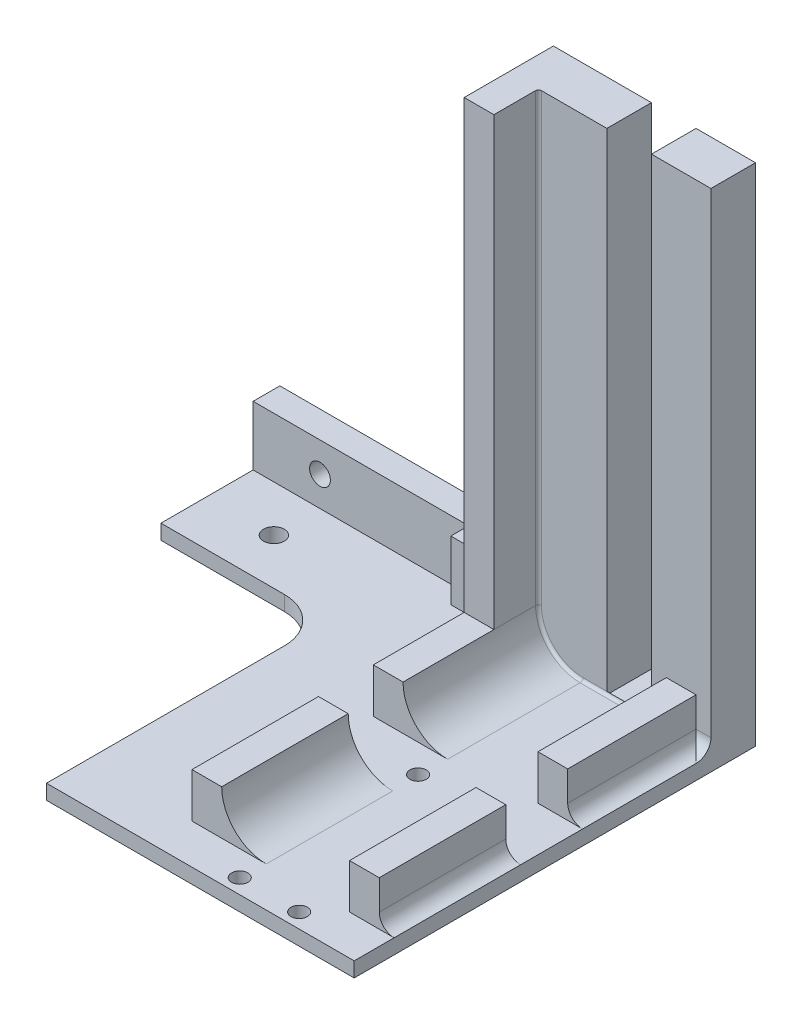
from build123d import *

# Parameters (mm, degrees)
BOSS_EXTRUDE1_DEPTH      = 250
BOSS_EXTRUDE2_DEPTH      = 50
BOSS_EXTRUDE2_2_DEPTH    = 50
LPATTERN1_COUNT          = 4
LPATTERN1_PITCH          = 60
SKETCH2_R                = 2.75
CUT_EXTRUDE1_DEPTH       = 251.864711302
UPPER_ACRYLIC_SUPP_W     = 20
UPPER_ACRYLIC_SUPP_H     = 250
BOSS_EXTRUDE3_DEPTH      = 5
UPPER_ACRYLIC_SUPP_3_W   = 10
UPPER_ACRYLIC_SUPP_3_H   = 66.073604859
UPPER_ACRYLIC_SUPP_3_H_2 = 41.475217291
UPPER_ACRYLIC_SUPP_3_H_3 = 42.557179481
UPPER_ACRYLIC_SUPP_3_H_4 = 45.558340935
BOSS_EXTRUDE4_DEPTH      = 15
FILLET1_R                = 15
SKETCH4_W                = 60
SKETCH4_H                = 15
BOSS_EXTRUDE5_DEPTH      = 5
SKETCH4_3_W              = 60
SKETCH4_3_H              = 15
BOSS_EXTRUDE6_DEPTH      = 60
SKETCH5_W                = 10
SKETCH5_H                = 45
BOSS_EXTRUDE7_DEPTH      = 15
BOSS_EXTRUDE8_START      = 250
SKETCH5_3_W              = 10
SKETCH5_3_H              = 45
BOSS_EXTRUDE8_DEPTH      = 15
FILLET2_R                = 1
SKETCH6_W                = 6
SKETCH6_H                = 60
CUT_EXTRUDE2_DEPTH       = 6
BOSS_EXTRUDE9_DEPTH      = 30
SKETCH8_W                = 333.602701612
SKETCH8_H                = 59.031331047
CUT_EXTRUDE3_DEPTH       = 150
SKETCH9_W                = 6
SKETCH9_H                = 20
CLOTH_ESCAPE_GAP_DEPTH   = 20
SKETCH11_W               = 9
SKETCH11_H               = 20
BOSS_EXTRUDE11_DEPTH     = 100
CUT_EXTRUDE4_DEPTH       = 68
SKETCH13_W               = 40
SKETCH13_H               = 5
BOSS_EXTRUDE13_DEPTH     = 100
CUT_EXTRUDE5_DEPTH       = 100
FILLET3_R                = 15
BOSS_EXTRUDE14_START     = -5
BOSS_EXTRUDE14_DEPTH     = 25
CUT_EXTRUDE6_DEPTH       = 30
CUT_EXTRUDE6_DEPTH_BACK  = 10
SKETCH16_5_W             = 8.5
SKETCH16_5_H             = 41.475217291
SKETCH16_5_H_2           = 42.557179481
SKETCH16_5_W_2           = 1.5
SKETCH16_5_H_3           = 42.177819043
SKETCH16_5_H_4           = 20.831100018
SKETCH16_5_H_5           = 17.311395043
SKETCH16_5_H_6           = 18.573684265
SKETCH16_5_H_7           = 65.073604859
SKETCH16_6_W             = 8.5
SKETCH16_6_H             = 41.475217291
SKETCH16_6_H_2           = 42.557179481
SKETCH16_6_W_2           = 1.5
SKETCH16_6_H_3           = 42.177819043
SKETCH16_6_H_4           = 20.831100018
SKETCH16_6_H_5           = 17.311395043
SKETCH16_6_H_6           = 18.573684265
SKETCH16_6_H_7           = 65.073604859
BOSS_EXTRUDE15_DEPTH     = 5
BOSS_EXTRUDE16_DEPTH     = 20
SKETCH16_8_W             = 8.5
SKETCH16_8_H             = 41.475217291
SKETCH16_8_H_2           = 42.557179481
SKETCH16_8_W_2           = 1.5
SKETCH16_8_H_3           = 42.177819043
SKETCH16_8_H_4           = 65.073604859
BOSS_EXTRUDE17_DEPTH     = 15
BOSS_EXTRUDE18_START     = -5
BOSS_EXTRUDE18_DEPTH     = 25
FILLET4_R                = 5
BOSS_EXTRUDE21_START     = 145
BOSS_EXTRUDE21_DEPTH     = 170
SKETCH19_R               = 3.5
CUT_EXTRUDE7_DEPTH       = 10
CUT_EXTRUDE8_DEPTH       = 355
CUT_EXTRUDE8_DEPTH_BACK  = 10
SKETCH20_R               = 3.5
SKETCH21_W               = 15
SKETCH21_H               = 197.501027769
CUT_EXTRUDE9_DEPTH       = 130
SKETCH22_W               = 160
SKETCH22_H               = 135
SKETCH22_H_2             = 10
CUT_EXTRUDE10_DEPTH      = 270


with BuildPart() as part:
    # profile → Boss-Extrude1 (new body)
    with BuildSketch(Plane.XY):
        Polygon((-14.746446609, 10.353553391), (-5.253553391, 10.353553391), (5.667330529, 10.353553391), (14.746446609, 10.353553391), (20, 10.353553391), (20, 15.353553391), (-20, 15.353553391), (-20, 10.353553391), align=None)
    extrude(amount=BOSS_EXTRUDE1_DEPTH)

    # Sketch2 → Cut-Extrude1 (cut, through all)
    with BuildSketch(Plane.XZ.offset(-10.353553391)):
        with Locations(Location((-10, 175, 0), (0, 0, 270))):
            Circle(SKETCH2_R)
        with Locations(Location((10, 175, 0), (0, 0, 270))):
            Circle(SKETCH2_R)
        with Locations(Location((-10, 115, 0), (0, 0, 270))):
            Circle(SKETCH2_R)
        with Locations(Location((10, 115, 0), (0, 0, 270))):
            Circle(SKETCH2_R)
        with Locations(Location((-10, 55, 0), (0, 0, 270))):
            Circle(SKETCH2_R)
        with Locations(Location((10, 55, 0), (0, 0, 270))):
            Circle(SKETCH2_R)
    extrude(amount=-CUT_EXTRUDE1_DEPTH, mode=Mode.SUBTRACT)

    # upper_acrylic_supp → Boss-Extrude3 (add)
    with BuildSketch(Plane(origin=(0, 15.353553391, 0), x_dir=(1, 0, 0), z_dir=(0, 1, 0))):
        with Locations((-30, -125)):
            Rectangle(UPPER_ACRYLIC_SUPP_W, UPPER_ACRYLIC_SUPP_H)
    extrude(amount=-BOSS_EXTRUDE3_DEPTH)

    # upper_acrylic_supp<3> → Boss-Extrude4 (add)
    with BuildSketch(Plane(origin=(0, 15.353553391, 0), x_dir=(1, 0, 0), z_dir=(0, 1, 0))):
        with Locations((-29.5, -216.963197571)):
            Rectangle(UPPER_ACRYLIC_SUPP_3_W, UPPER_ACRYLIC_SUPP_3_H)
        with Locations((-29.5, -144.615102231)):
            Rectangle(UPPER_ACRYLIC_SUPP_3_W, UPPER_ACRYLIC_SUPP_3_H_2)
        with Locations((-29.5, -85.287508801)):
            Rectangle(UPPER_ACRYLIC_SUPP_3_W, UPPER_ACRYLIC_SUPP_3_H_3)
        with Locations((-29.5, -22.779170468)):
            Rectangle(UPPER_ACRYLIC_SUPP_3_W, UPPER_ACRYLIC_SUPP_3_H_4)
    extrude(amount=BOSS_EXTRUDE4_DEPTH)

    # Fillet1
    fillet1_edges = [part.edges().sort_by_distance(p)[0] for p in [
        (-24.5, 15.353553391, 22.779170467),
        (-24.5, 15.353553391, 85.287508801),
        (-24.5, 15.353553391, 144.615102231),
        (-24.5, 15.353553391, 216.963197571),
    ]]
    fillet(fillet1_edges, radius=FILLET1_R - 0.0001)  # a hair under: the kernel refuses the full size



with BuildPart() as body_2:
    # Sketch1<3> → Boss-Extrude2 (new body)
    with BuildSketch(Plane.XY):
        Polygon((-7.253553391, 8.353553391), (-8.119669914, 7.487436867), (-5.5, 7.487436867), (-4.987436867, 7.487436867), (-5.5, 6.974873734), (-7.874873734, 4.6), (-12.125126266, 4.6), (-14.5, 6.974873734), (-15.012563133, 7.487436867), (-14.5, 7.487436867), (-11.880330086, 7.487436867), (-12.746446609, 8.353553391), (-14.746446609, 10.353553391), (-5.253553391, 10.353553391), align=None)
    boss_extrude2 = extrude(amount=BOSS_EXTRUDE2_DEPTH)


with BuildPart() as body_3:
    # Sketch1<3> → Boss-Extrude2 2 (new body)
    with BuildSketch(Plane.XY):
        Polygon((12.746446609, 8.353553391), (11.880330086, 7.487436867), (14.5, 7.487436867), (15.012563133, 7.487436867), (14.5, 6.974873734), (12.125126266, 4.6), (7.874873734, 4.6), (5.5, 6.974873734), (4.987436867, 7.487436867), (5.5, 7.487436867), (8.533447053, 7.487436867), (7.667330529, 8.353553391), (5.667330529, 10.353553391), (14.746446609, 10.353553391), align=None)
    boss_extrude2_2 = extrude(amount=BOSS_EXTRUDE2_2_DEPTH)


with BuildPart() as lpattern1_1:
    # LPattern1: pattern copy
    add(boss_extrude2.moved(Location(Vector(0, 0, 1) * (1 * LPATTERN1_PITCH))))


with BuildPart() as lpattern1_2:
    # LPattern1: pattern copy
    add(boss_extrude2.moved(Location(Vector(0, 0, 1) * (2 * LPATTERN1_PITCH))))


with BuildPart() as lpattern1_3:
    # LPattern1: pattern copy
    add(boss_extrude2.moved(Location(Vector(0, 0, 1) * (3 * LPATTERN1_PITCH))))


with BuildPart() as lpattern1_4:
    # LPattern1: pattern copy
    add(boss_extrude2_2.moved(Location(Vector(0, 0, 1) * (1 * LPATTERN1_PITCH))))


with BuildPart() as lpattern1_5:
    # LPattern1: pattern copy
    add(boss_extrude2_2.moved(Location(Vector(0, 0, 1) * (2 * LPATTERN1_PITCH))))


with BuildPart() as lpattern1_6:
    # LPattern1: pattern copy
    add(boss_extrude2_2.moved(Location(Vector(0, 0, 1) * (3 * LPATTERN1_PITCH))))


with BuildPart() as part_1:
    add(part.part)

    add(body_2.part)  # Boss-Extrude5 merges body 2

    add(body_3.part)  # Boss-Extrude5 merges body 3
    # Sketch4 → Boss-Extrude5 (add, symmetric)
    with BuildSketch(Plane(origin=(0, 15.353553391, 0), x_dir=(1, 0, 0), z_dir=(0, 1, 0))):
        with Locations((-10, -257.5)):
            Rectangle(SKETCH4_W, SKETCH4_H)
        with Locations((-10, 7.5)):
            Rectangle(SKETCH4_W, SKETCH4_H)
    extrude(amount=BOSS_EXTRUDE5_DEPTH, both=True)

    # Sketch4<3> → Boss-Extrude6 (add)
    with BuildSketch(Plane(origin=(0, 15.353553391, 0), x_dir=(1, 0, 0), z_dir=(0, 1, 0))):
        with Locations((-10, -257.5)):
            Rectangle(SKETCH4_3_W, SKETCH4_3_H)
        with Locations((-10, 7.5)):
            Rectangle(SKETCH4_3_W, SKETCH4_3_H)
    extrude(amount=BOSS_EXTRUDE6_DEPTH)

    # Sketch5 → Boss-Extrude7 (add)
    with BuildSketch(Plane(origin=(0, 0, 250), x_dir=(-1, 0, 0), z_dir=(0, 0, -1))):
        with Locations((29.5, 52.853553391)):
            Rectangle(SKETCH5_W, SKETCH5_H)
    extrude(amount=BOSS_EXTRUDE7_DEPTH)

    # Sketch5<3> → Boss-Extrude8 (add)
    with BuildSketch(Plane(origin=(0, 0, 250), x_dir=(-1, 0, 0), z_dir=(0, 0, -1)).offset(BOSS_EXTRUDE8_START)):
        with Locations((29.5, 52.853553391)):
            Rectangle(SKETCH5_3_W, SKETCH5_3_H)
    extrude(amount=-BOSS_EXTRUDE8_DEPTH)

    # Fillet2
    fillet2_edges = [part_1.edges().sort_by_distance(p)[0] for p in [
        (-24.5, 52.853503391, 250),
        (-24.5, 52.853503391, 0),
        (5.24995, 15.353553391, 250),
        (-20.106631007, 19.746922384, 250),
        (-20.106631007, 19.746922384, 0),
        (5.24995, 15.353553391, 0),
    ]]
    fillet(fillet2_edges, radius=FILLET2_R)

    # Sketch6 → Cut-Extrude2 (cut)
    with BuildSketch(Plane.ZY.offset(40)):
        with Locations((253, 45.353553391)):
            Rectangle(SKETCH6_W, SKETCH6_H)
        with Locations((-3, 45.353553391)):
            Rectangle(SKETCH6_W, SKETCH6_H)
    extrude(amount=-CUT_EXTRUDE2_DEPTH, mode=Mode.SUBTRACT)

    # Sketch7 → Boss-Extrude9 (add)
    with BuildSketch(Plane.ZY.offset(40)):
        Polygon((265, 75.353553391), (256, 75.353553391), (256, 15.353553391), (-6, 15.353553391), (-6, 75.353553391), (-15, 75.353553391), (-15, 10.353553391), (265, 10.353553391), align=None)
    extrude(amount=BOSS_EXTRUDE9_DEPTH)

    # Sketch8 → Cut-Extrude3 (cut)
    with BuildSketch(Plane.ZY.offset(70)):
        with Locations((122.426839416, 64.869218915)):
            Rectangle(SKETCH8_W, SKETCH8_H)
    extrude(amount=-CUT_EXTRUDE3_DEPTH, mode=Mode.SUBTRACT)

    # Sketch9 → cloth_escape_gap (add)
    with BuildSketch(Plane.ZY.offset(34)):
        with Locations((253, 25.353553391)):
            Rectangle(SKETCH9_W, SKETCH9_H)
        with Locations((-3, 25.353553391)):
            Rectangle(SKETCH9_W, SKETCH9_H)
    extrude(amount=CLOTH_ESCAPE_GAP_DEPTH)

    # Sketch11 → Boss-Extrude11 (add)
    with BuildSketch(Plane.ZY.offset(70)):
        with Locations((-10.5, 25.353553391)):
            Rectangle(SKETCH11_W, SKETCH11_H)
        with Locations((260.5, 25.353553391)):
            Rectangle(SKETCH11_W, SKETCH11_H)
    extrude(amount=BOSS_EXTRUDE11_DEPTH)

    # Sketch12 → Cut-Extrude4 (cut)
    with BuildSketch(Plane.XZ.offset(-10.353553391)):
        Polygon((-170, 265), (-70, 265), (-170, 260.5), align=None)
        Polygon((-70, -15), (-170, -10.5), (-170, -15), align=None)
    extrude(amount=-CUT_EXTRUDE4_DEPTH, mode=Mode.SUBTRACT)

    # Sketch13 → Boss-Extrude13 (add)
    with BuildSketch(Plane.ZY.offset(70)):
        with Locations((5, 12.853553391)):
            Rectangle(SKETCH13_W, SKETCH13_H)
        with Locations((245, 12.853553391)):
            Rectangle(SKETCH13_W, SKETCH13_H)
    extrude(amount=BOSS_EXTRUDE13_DEPTH)

    # Sketch14 → Cut-Extrude5 (cut)
    with BuildSketch(Plane(origin=(0, 15.353553391, 0), x_dir=(1, 0, 0), z_dir=(0, 1, 0))):
        Polygon((-70, -265), (-170, -260.5), (-170, -265), align=None)
        Polygon((-170, 15), (-170, 10.5), (-70, 15), align=None)
    extrude(amount=-CUT_EXTRUDE5_DEPTH, mode=Mode.SUBTRACT)

    # Fillet3
    fillet3_edges = [part_1.edges().sort_by_distance(p)[0] for p in [
        (-70, 12.853553391, 25),
        (-70, 12.853553391, 225),
    ]]
    fillet(fillet3_edges, radius=FILLET3_R)

    # Sketch16 → Boss-Extrude14 (add)
    with BuildSketch(Plane(origin=(0, 15.353553391, 0), x_dir=(1, 0, 0), z_dir=(0, 1, 0)).offset(BOSS_EXTRUDE14_START)):
        Polygon((28.5, 0), (33.5, 0), (33.5, 15), (18.5, 15), (18.5, 0), align=None)
        Polygon((18.5, -250), (18.5, -265), (33.5, -265), (33.5, -250), (28.5, -250), align=None)
    extrude(amount=BOSS_EXTRUDE14_DEPTH)

    # Sketch16<5> → Cut-Extrude6 (cut, two sides: drawn at the far end of the back side and taken through both)
    with BuildSketch(Plane(origin=(0, 15.353553391, 0), x_dir=(1, 0, 0), z_dir=(0, 1, 0)).offset(-CUT_EXTRUDE6_DEPTH_BACK)):
        Polygon((18.5, -250), (18.5, -265), (33.5, -265), (33.5, -250), (28.5, -250), align=None)
        Polygon((28.5, -250), (33.5, -250), (33.5, 0), (28.5, 0), (28.5, -43.177819043), (20, -43.177819043), (20, -64.008919061), (28.5, -64.008919061), (28.5, -106.566098542), (20, -106.566098542), (20, -123.877493585), (28.5, -123.877493585), (28.5, -165.352710876), (20, -165.352710876), (20, -183.926395141), (28.5, -183.926395141), align=None)
        with Locations((24.25, -144.615102231)):
            Rectangle(SKETCH16_5_W, SKETCH16_5_H)
        with Locations((24.25, -85.287508801)):
            Rectangle(SKETCH16_5_W, SKETCH16_5_H_2)
        Polygon((28.5, -43.177819043), (28.5, 0), (18.5, 0), (18.5, -1), (20, -1), (20, -43.177819043), align=None)
        Polygon((28.5, 0), (33.5, 0), (33.5, 15), (18.5, 15), (18.5, 0), align=None)
        with Locations((19.25, -22.088909521)):
            Rectangle(SKETCH16_5_W_2, SKETCH16_5_H_3)
        with Locations((19.25, -53.593369052)):
            Rectangle(SKETCH16_5_W_2, SKETCH16_5_H_4)
        with Locations((19.25, -85.287508801)):
            Rectangle(SKETCH16_5_W_2, SKETCH16_5_H_2)
        with Locations((19.25, -115.221796064)):
            Rectangle(SKETCH16_5_W_2, SKETCH16_5_H_5)
        with Locations((19.25, -144.615102231)):
            Rectangle(SKETCH16_5_W_2, SKETCH16_5_H)
        with Locations((19.25, -174.639553009)):
            Rectangle(SKETCH16_5_W_2, SKETCH16_5_H_6)
        with Locations((19.25, -216.463197571)):
            Rectangle(SKETCH16_5_W_2, SKETCH16_5_H_7)
        Polygon((18.5, -249), (18.5, -250), (28.5, -250), (28.5, -183.926395141), (20, -183.926395141), (20, -249), align=None)
    extrude(amount=CUT_EXTRUDE6_DEPTH + CUT_EXTRUDE6_DEPTH_BACK, mode=Mode.SUBTRACT)

    # Sketch16<6> → Boss-Extrude15 (add)
    with BuildSketch(Plane(origin=(0, 15.353553391, 0), x_dir=(1, 0, 0), z_dir=(0, 1, 0))):
        Polygon((28.5, -250), (33.5, -250), (33.5, 0), (28.5, 0), (28.5, -43.177819043), (20, -43.177819043), (20, -64.008919061), (28.5, -64.008919061), (28.5, -106.566098542), (20, -106.566098542), (20, -123.877493585), (28.5, -123.877493585), (28.5, -165.352710876), (20, -165.352710876), (20, -183.926395141), (28.5, -183.926395141), align=None)
        Polygon((18.5, -249), (18.5, -250), (28.5, -250), (28.5, -183.926395141), (20, -183.926395141), (20, -249), align=None)
        Polygon((18.5, -250), (18.5, -265), (33.5, -265), (33.5, -250), (28.5, -250), align=None)
        with Locations((24.25, -144.615102231)):
            Rectangle(SKETCH16_6_W, SKETCH16_6_H)
        with Locations((24.25, -85.287508801)):
            Rectangle(SKETCH16_6_W, SKETCH16_6_H_2)
        Polygon((28.5, -43.177819043), (28.5, 0), (18.5, 0), (18.5, -1), (20, -1), (20, -43.177819043), align=None)
        Polygon((28.5, 0), (33.5, 0), (33.5, 15), (18.5, 15), (18.5, 0), align=None)
        with Locations((19.25, -22.088909521)):
            Rectangle(SKETCH16_6_W_2, SKETCH16_6_H_3)
        with Locations((19.25, -53.593369052)):
            Rectangle(SKETCH16_6_W_2, SKETCH16_6_H_4)
        with Locations((19.25, -85.287508801)):
            Rectangle(SKETCH16_6_W_2, SKETCH16_6_H_2)
        with Locations((19.25, -115.221796064)):
            Rectangle(SKETCH16_6_W_2, SKETCH16_6_H_5)
        with Locations((19.25, -144.615102231)):
            Rectangle(SKETCH16_6_W_2, SKETCH16_6_H)
        with Locations((19.25, -174.639553009)):
            Rectangle(SKETCH16_6_W_2, SKETCH16_6_H_6)
        with Locations((19.25, -216.463197571)):
            Rectangle(SKETCH16_6_W_2, SKETCH16_6_H_7)
    extrude(amount=-BOSS_EXTRUDE15_DEPTH)

    # Sketch16<7> → Boss-Extrude16 (add)
    with BuildSketch(Plane(origin=(0, 15.353553391, 0), x_dir=(1, 0, 0), z_dir=(0, 1, 0))):
        Polygon((18.5, -250), (18.5, -265), (33.5, -265), (33.5, -250), (28.5, -250), align=None)
        Polygon((28.5, 0), (33.5, 0), (33.5, 15), (18.5, 15), (18.5, 0), align=None)
    extrude(amount=BOSS_EXTRUDE16_DEPTH)

    # Sketch16<8> → Boss-Extrude17 (add)
    with BuildSketch(Plane(origin=(0, 15.353553391, 0), x_dir=(1, 0, 0), z_dir=(0, 1, 0))):
        Polygon((18.5, -249), (18.5, -250), (28.5, -250), (28.5, -183.926395141), (20, -183.926395141), (20, -249), align=None)
        with Locations((24.25, -144.615102231)):
            Rectangle(SKETCH16_8_W, SKETCH16_8_H)
        with Locations((24.25, -85.287508801)):
            Rectangle(SKETCH16_8_W, SKETCH16_8_H_2)
        Polygon((28.5, -43.177819043), (28.5, 0), (18.5, 0), (18.5, -1), (20, -1), (20, -43.177819043), align=None)
        with Locations((19.25, -22.088909521)):
            Rectangle(SKETCH16_8_W_2, SKETCH16_8_H_3)
        with Locations((19.25, -85.287508801)):
            Rectangle(SKETCH16_8_W_2, SKETCH16_8_H_2)
        with Locations((19.25, -144.615102231)):
            Rectangle(SKETCH16_8_W_2, SKETCH16_8_H)
        with Locations((19.25, -216.463197571)):
            Rectangle(SKETCH16_8_W_2, SKETCH16_8_H_4)
    extrude(amount=BOSS_EXTRUDE17_DEPTH)

    # Sketch14<2> → Boss-Extrude18 (add)
    with BuildSketch(Plane(origin=(0, 15.353553391, 0), x_dir=(1, 0, 0), z_dir=(0, 1, 0)).offset(BOSS_EXTRUDE18_START)):
        Polygon((-70, -265), (-170, -260.5), (-170, -265), align=None)
        Polygon((-170, 15), (-170, 10.5), (-70, 15), align=None)
    extrude(amount=BOSS_EXTRUDE18_DEPTH)

    # Fillet4
    fillet4_edges = [part_1.edges().sort_by_distance(p)[0] for p in [
        (31, 15.353553391, 0),
        (28.5, 15.353553391, 21.588909521),
        (28.5, 15.353553391, 85.287508801),
        (28.5, 15.353553391, 144.615102231),
        (31, 15.353553391, 250),
        (28.5, 15.353553391, 216.963197571),
    ]]
    fillet(fillet4_edges, radius=FILLET4_R - 0.0001)  # a hair under: the kernel refuses the full size

    # Sketch18 → Boss-Extrude21 (add)
    with BuildSketch(Plane(origin=(0, 35.353553391, 0), x_dir=(1, 0, 0), z_dir=(0, 1, 0)).offset(BOSS_EXTRUDE21_START)):
        with BuildLine():
            Line((-34.5, -250), (-34.5, -265))
            Line((-34.5, -265), (33.5, -265))
            Line((33.5, -265), (33.5, -250))
            Line((33.5, -250), (-23.5, -250))
            ThreePointArc((-23.5, -250), (-24.207106781, -249.707106781), (-24.5, -249))
            Line((-24.5, -249), (-24.5, -235))
            Line((-24.5, -235), (-34.5, -235))
            Line((-34.5, -235), (-34.5, -250))
        make_face()
        with BuildLine():
            Line((-34.5, 15), (-34.5, 0))
            Line((-34.5, 0), (-34.5, -15))
            Line((-34.5, -15), (-24.5, -15))
            Line((-24.5, -15), (-24.5, -1))
            ThreePointArc((-24.5, -1), (-24.207106781, -0.292893219), (-23.5, 0))
            Line((-23.5, 0), (33.5, 0))
            Line((33.5, 0), (33.5, 15))
            Line((33.5, 15), (-34.5, 15))
        make_face()
    extrude(amount=-BOSS_EXTRUDE21_DEPTH)

    # Sketch19 → Cut-Extrude7 (cut)
    with BuildSketch(Plane(origin=(0, 15.353553391, 0), x_dir=(1, 0, 0), z_dir=(0, 1, 0))):
        with Locations(Location((-154, -9.5, 0), (0, 0, 270))):
            Circle(SKETCH19_R)
        with Locations(Location((-104, -9.5, 0), (0, 0, 270))):
            Circle(SKETCH19_R)
        with Locations(Location((-104, -240.5, 0), (0, 0, 270))):
            Circle(SKETCH19_R)
        with Locations(Location((-154, -240.5, 0), (0, 0, 270))):
            Circle(SKETCH19_R)
    extrude(amount=-CUT_EXTRUDE7_DEPTH, mode=Mode.SUBTRACT)

    # Sketch20 → Cut-Extrude8 (cut, two sides: drawn at the far end of the back side and taken through both)
    with BuildSketch(Plane(origin=(0, 0, 256), x_dir=(-1, 0, 0), z_dir=(0, 0, -1)).offset(-CUT_EXTRUDE8_DEPTH_BACK)):
        with Locations(Location((104, 25.353553391, 0), (0, 0, 180))):
            Circle(SKETCH20_R)
        with Locations(Location((154, 25.353553391, 0), (0, 0, 180))):
            Circle(SKETCH20_R)
    extrude(amount=CUT_EXTRUDE8_DEPTH + CUT_EXTRUDE8_DEPTH_BACK, mode=Mode.SUBTRACT)

    # Sketch21 → Cut-Extrude9 (cut)
    with BuildSketch(Plane.XY):
        with Locations((6, 114.104067276)):
            Rectangle(SKETCH21_W, SKETCH21_H)
    extrude(amount=-CUT_EXTRUDE9_DEPTH, mode=Mode.SUBTRACT)


with BuildPart() as cut_extrude10_tool:
    # Sketch22 → Cut-Extrude10 (new body)
    with BuildSketch(Plane(origin=(0, 0, 0), x_dir=(1, 0, 0), z_dir=(0, 1, 0))):
        with Locations((-46.5, -197.5)):
            Rectangle(SKETCH22_W, SKETCH22_H)
        Polygon((-126.5, 15), (-186.5, 15), (-186.5, -265), (-126.5, -265), (-126.5, -130), (-126.5, -120), align=None)
        with Locations((-46.5, -125)):
            Rectangle(SKETCH22_W, SKETCH22_H_2)
    extrude(amount=CUT_EXTRUDE10_DEPTH)


with BuildPart() as part_2:
    add(part_1.part)

    # Cut-Extrude10: cut by cut_extrude10_tool
    add(cut_extrude10_tool.part, mode=Mode.SUBTRACT)


with BuildPart() as lpattern1_2_1:
    add(lpattern1_2.part)

    # Cut-Extrude10: cut by cut_extrude10_tool
    add(cut_extrude10_tool.part, mode=Mode.SUBTRACT)


with BuildPart() as lpattern1_3_1:
    add(lpattern1_3.part)

    # Cut-Extrude10: cut by cut_extrude10_tool
    add(cut_extrude10_tool.part, mode=Mode.SUBTRACT)


with BuildPart() as lpattern1_5_1:
    add(lpattern1_5.part)

    # Cut-Extrude10: cut by cut_extrude10_tool
    add(cut_extrude10_tool.part, mode=Mode.SUBTRACT)


with BuildPart() as lpattern1_6_1:
    add(lpattern1_6.part)

    # Cut-Extrude10: cut by cut_extrude10_tool
    add(cut_extrude10_tool.part, mode=Mode.SUBTRACT)


solid = Compound([lpattern1_1.part, lpattern1_4.part, part_2.part])
